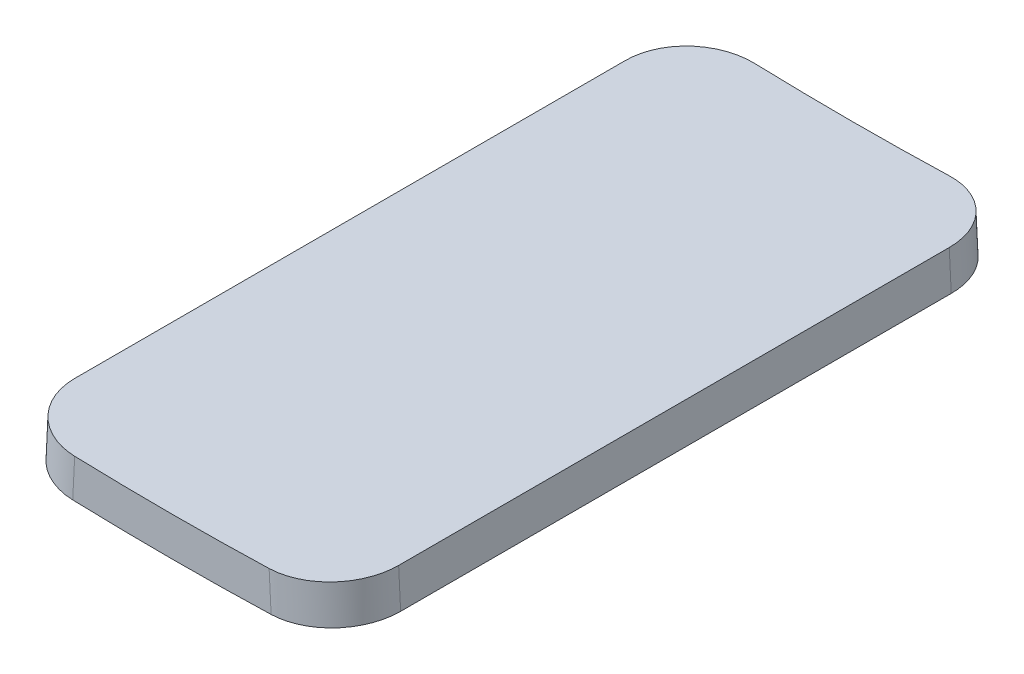
from build123d import *

# Parameters (mm, degrees)
SM_BASE_FLANGE_1_DEPTH = 105
FILLET_1_R             = 20


# Sheet-metal steps are written as plain solids
with BuildPart() as part:
    # Sketch 1 → 基体-法兰1 (new, symmetric)
    with BuildSketch(Plane.XY):
        with BuildLine():
            ThreePointArc((-50, -976.220390076), (0, -977.5), (50, -976.220390076))
            Line((50, -976.220390076), (50.613810742, -988.20468131))
            ThreePointArc((50.613810742, -988.20468131), (0, -989.5), (-50.613810742, -988.20468131))
            Line((-50.613810742, -988.20468131), (-50, -976.220390076))
        make_face()
    extrude(amount=SM_BASE_FLANGE_1_DEPTH, both=True)

    # 圆角1
    fillet_1_edges = [part.edges().sort_by_distance(p)[0] for p in [
        (-50.306905371, -982.212535693, 105),
        (-50.306905371, -982.212535693, -105),
        (50.306905371, -982.212535693, -105),
        (50.306905371, -982.212535693, 105),
    ]]
    fillet(fillet_1_edges, radius=FILLET_1_R)


solid = part.part
